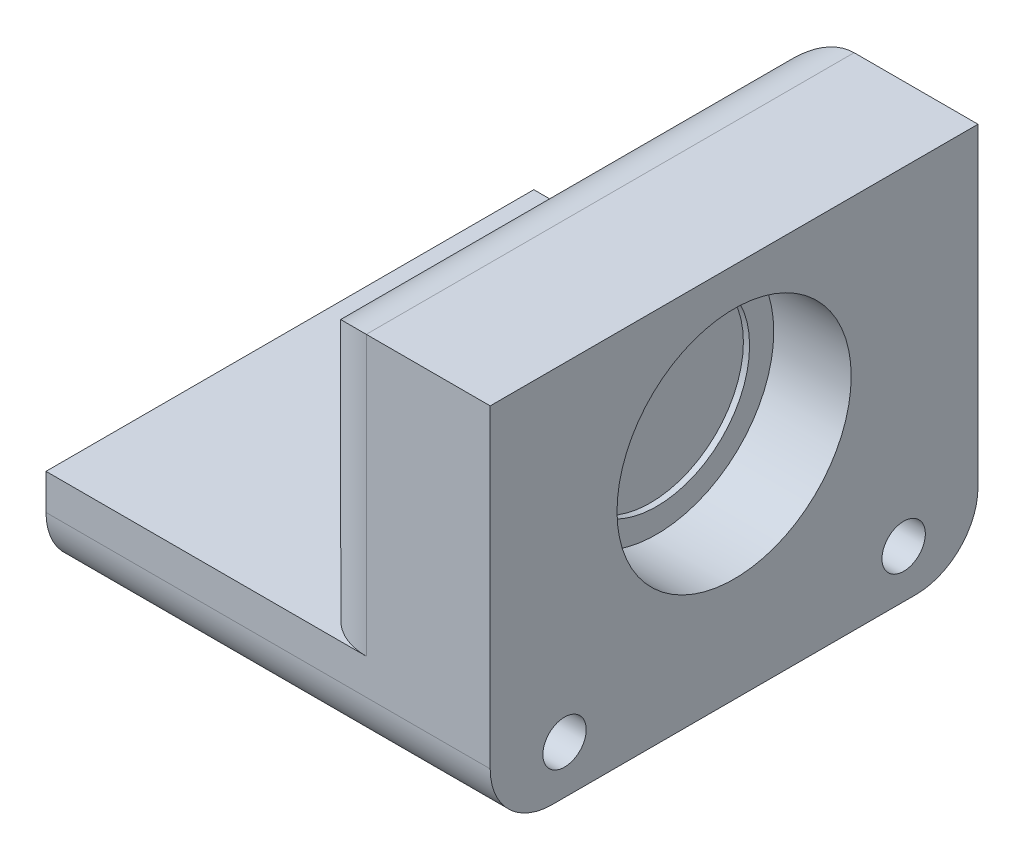
from build123d import *

# Parameters (mm, degrees)
BOSS_EXTRUDE1_DEPTH                            = 20
SKETCH2_R                                      = 1.27
CUT_EXTRUDE1_DEPTH                             = 4.000000128
SKETCH3_R                                      = 4.8006
CUT_EXTRUDE2_DEPTH                             = 3.175
SKETCH4_R                                      = 3.81
CUT_EXTRUDE3_DEPTH                             = 0.254
CUT_EXTRUDE4_START                             = -3.175
SKETCH5_R                                      = 4.8006
CUT_EXTRUDE4_DEPTH                             = 3.175
CUT_EXTRUDE5_START                             = -0.254
SKETCH6_R                                      = 3.81
CUT_EXTRUDE5_DEPTH                             = 0.254
CBORE_FOR_0_SOCKET_HEAD_CAP_SCREW1_D           = 1.778
CBORE_FOR_0_SOCKET_HEAD_CAP_SCREW1_CBORE_D     = 3.175
CBORE_FOR_0_SOCKET_HEAD_CAP_SCREW1_CBORE_DEPTH = 14.732
FILLET1_R                                      = 2.54


with BuildPart() as part:
    # Sketch1 → Boss-Extrude1 (new body)
    with BuildSketch(Plane.XY):
        Polygon((-71.742285041, 0), (-71.742285041, -4), (-53.530479711, -4), (-53.530479711, 11.43), (-61.150490131, 11.43), (-61.150490131, 0), align=None)
    extrude(amount=-BOSS_EXTRUDE1_DEPTH)

    # Sketch2 → Cut-Extrude1 (cut)
    with BuildSketch(Plane.ZY.offset(71.742285041)):
        with Locations((-12.286, -2)):
            Circle(SKETCH2_R)
        with Locations(Location((-7.714, -2, 0), (0, 0, 180))):
            Circle(SKETCH2_R)
    extrude(amount=-CUT_EXTRUDE1_DEPTH, mode=Mode.SUBTRACT)

    # Sketch3 → Cut-Extrude2 (cut)
    with BuildSketch(Plane.ZY.offset(61.150490131)):
        with Locations((-10, 5.08)):
            Circle(SKETCH3_R)
    extrude(amount=-CUT_EXTRUDE2_DEPTH, mode=Mode.SUBTRACT)

    # Sketch4 → Cut-Extrude3 (cut)
    with BuildSketch(Plane.ZY.offset(57.975490131)):
        with Locations((-10, 5.08)):
            Circle(SKETCH4_R)
    extrude(amount=-CUT_EXTRUDE3_DEPTH, mode=Mode.SUBTRACT)

    # Sketch5 → Cut-Extrude4 (cut)
    with BuildSketch(Plane(origin=(-53.530479711, 0, 0), x_dir=(0, 0, -1), z_dir=(1, 0, 0)).offset(CUT_EXTRUDE4_START)):
        with Locations(Location((10, 5.08, 0), (0, 0, 180))):
            Circle(SKETCH5_R)
    extrude(amount=CUT_EXTRUDE4_DEPTH, mode=Mode.SUBTRACT)

    # Sketch6 → Cut-Extrude5 (cut)
    with BuildSketch(Plane(origin=(-56.705479711, 0, 0), x_dir=(0, 0, -1), z_dir=(1, 0, 0)).offset(CUT_EXTRUDE5_START)):
        with Locations(Location((10, 5.08, 0), (0, 0, 180))):
            Circle(SKETCH6_R)
    extrude(amount=CUT_EXTRUDE5_DEPTH, mode=Mode.SUBTRACT)

    # CBORE for #0 Socket Head Cap Screw1 (through all)
    with Locations(Plane.ZY.offset(71.742285041)):
        with Locations((-16.952, -2.032), (-3.048, -2.032)):
            CounterBoreHole(CBORE_FOR_0_SOCKET_HEAD_CAP_SCREW1_D / 2, CBORE_FOR_0_SOCKET_HEAD_CAP_SCREW1_CBORE_D / 2, CBORE_FOR_0_SOCKET_HEAD_CAP_SCREW1_CBORE_DEPTH)

    # Fillet1
    # the kernel refuses this fillet: 2.54 mm, written as the material it takes off along each edge
    with BuildSketch(Plane(origin=(-78.092285041, -4, -20), x_dir=(0, 1, 0), z_dir=(1, 0, 0))) as fillet1_piece_1:
        with BuildLine():
            CenterArc((FILLET1_R, FILLET1_R), FILLET1_R, 180, 90)
            Line((0, FILLET1_R), (0, 0))
            Line((0, 0), (FILLET1_R, 0))
        make_face()
    extrude(amount=30.91180533, mode=Mode.SUBTRACT)
    with BuildSketch(Plane(origin=(-61.150490131, 11.43, 6.35), x_dir=(0, -1, 0), z_dir=(0, 0, -1))) as fillet1_piece_2:
        with BuildLine():
            CenterArc((FILLET1_R, -FILLET1_R), FILLET1_R, 90, 90)
            Line((0, -FILLET1_R), (0, 0))
            Line((0, 0), (FILLET1_R, 0))
        make_face()
    extrude(amount=32.7, mode=Mode.SUBTRACT)
    with BuildSketch(Plane(origin=(-61.150490131, 17.78, -20), x_dir=(1, 0, 0), z_dir=(0, -1, 0))) as fillet1_piece_3:
        with BuildLine():
            CenterArc((FILLET1_R, FILLET1_R), FILLET1_R, 180, 90)
            Line((0, FILLET1_R), (0, 0))
            Line((0, 0), (FILLET1_R, 0))
        make_face()
    extrude(amount=17.78, mode=Mode.SUBTRACT)
    with BuildSketch(Plane(origin=(-61.150490131, 17.78, 0), x_dir=(1, 0, 0), z_dir=(0, -1, 0))) as fillet1_piece_4:
        with BuildLine():
            CenterArc((FILLET1_R, -FILLET1_R), FILLET1_R, 90, 90)
            Line((0, -FILLET1_R), (0, 0))
            Line((0, 0), (FILLET1_R, 0))
        make_face()
    extrude(amount=17.78, mode=Mode.SUBTRACT)
    with BuildSketch(Plane(origin=(-78.092285041, -4, 0), x_dir=(0, 1, 0), z_dir=(1, 0, 0))) as fillet1_piece_5:
        with BuildLine():
            CenterArc((FILLET1_R, -FILLET1_R), FILLET1_R, 90, 90)
            Line((0, -FILLET1_R), (0, 0))
            Line((0, 0), (FILLET1_R, 0))
        make_face()
    extrude(amount=30.91180533, mode=Mode.SUBTRACT)


solid = part.part
